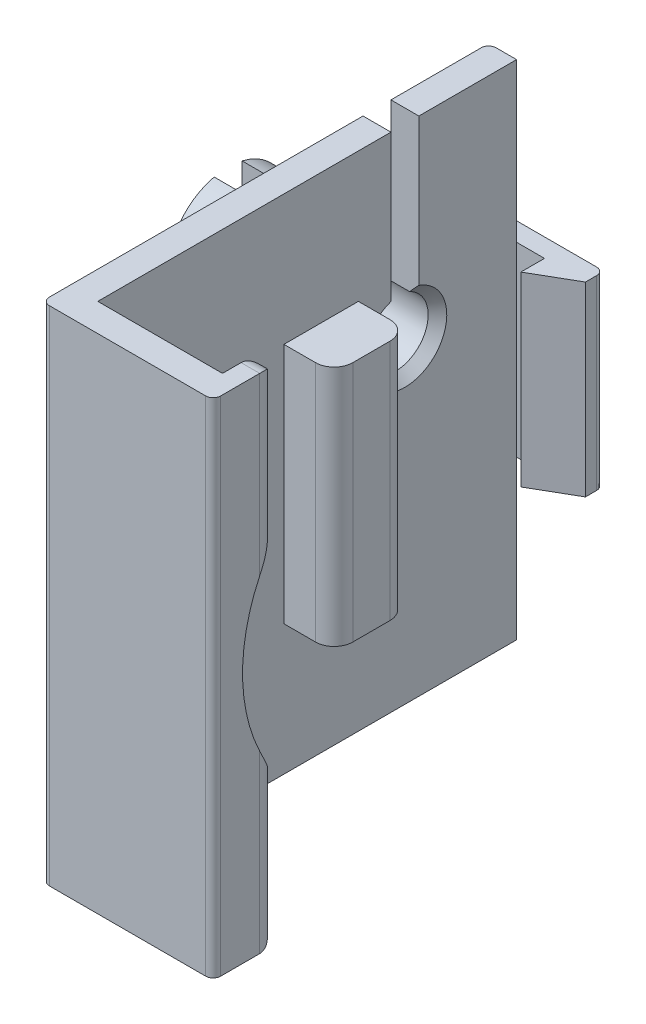
from build123d import *

# Parameters (mm, degrees)
BOSS_EXTRUDE1_DEPTH      = 5
BOSS_EXTRUDE1_DEPTH_BACK = 5
SKETCH2_W                = 3.7
SKETCH2_H                = 10
BOSS_EXTRUDE2_DEPTH      = 1
SKETCH3_W                = 1
SKETCH3_H                = 10
BOSS_EXTRUDE3_DEPTH      = 1.5
SKETCH4_W                = 6.7
SKETCH4_H                = 27
SKETCH4_W_2              = 1.5
BOSS_EXTRUDE4_DEPTH      = 1.5
SKETCH5_W                = 4
SKETCH5_H                = 13
BOSS_EXTRUDE5_DEPTH      = 2.7
CUT_EXTRUDE1_DEPTH       = 29.339724769
BOSS_EXTRUDE6_START      = -1.5
BOSS_EXTRUDE6_DEPTH      = 8
CUT_EXTRUDE2_START       = -3.25
SKETCH8_W                = 4.8
SKETCH8_H                = 6.5
CUT_EXTRUDE2_DEPTH       = 3.25
FILLET4_R                = 1
CHAMFER1_SIZE            = 2
CHAMFER3_SIZE            = 0.5
SKETCH4_3_W              = 1
SKETCH4_3_H              = 27
BOSS_EXTRUDE7_DEPTH      = 2
SKETCH4_4_W              = 1
SKETCH4_4_H              = 27
BOSS_EXTRUDE8_DEPTH      = 1.5
FILLET6_R                = 1
FILLET8_R                = 0.4
SKETCH9_R                = 9.5
CUT_EXTRUDE3_DEPTH       = 32.948239388


with BuildPart() as part:
    # Sketch1 → Boss-Extrude1 (new, two sides: drawn at the far end of the back side and taken through both)
    with BuildSketch(Plane(origin=(0, 0, 0), x_dir=(1, 0, 0), z_dir=(0, 1, 0)).offset(-BOSS_EXTRUDE1_DEPTH_BACK)):
        Polygon((0, 0), (-2.2, 0), (-2.2, -1.270170592), align=None)
    extrude(amount=BOSS_EXTRUDE1_DEPTH + BOSS_EXTRUDE1_DEPTH_BACK)

    # Sketch2 → Boss-Extrude2 (add)
    with BuildSketch(Plane(origin=(0, 0, 0), x_dir=(-1, 0, 0), z_dir=(0, 0, -1))):
        with Locations((1.85, 0)):
            Rectangle(SKETCH2_W, SKETCH2_H)
    extrude(amount=BOSS_EXTRUDE2_DEPTH)

    # Sketch3 → Boss-Extrude3 (add)
    with BuildSketch(Plane.ZY.offset(3.7)):
        Polygon((0, -5), (0, -13.5), (22.5, -13.5), (22.5, 13.5), (0, 13.5), (0, 5), align=None)
        with Locations((-0.5, 0)):
            Rectangle(SKETCH3_W, SKETCH3_H)
    extrude(amount=BOSS_EXTRUDE3_DEPTH)

    # Sketch4 → Boss-Extrude4 (add)
    with BuildSketch(Plane.XY.offset(22.5)):
        with Locations((-0.35, 0)):
            Rectangle(SKETCH4_W, SKETCH4_H)
        with Locations((-4.45, 0)):
            Rectangle(SKETCH4_W_2, SKETCH4_H)
    extrude(amount=BOSS_EXTRUDE4_DEPTH)

    # Sketch5 → Boss-Extrude5 (add)
    with BuildSketch(Plane(origin=(-3.7, 0, 0), x_dir=(0, 0, -1), z_dir=(1, 0, 0))):
        with Locations((-10.5, 0)):
            Rectangle(SKETCH5_W, SKETCH5_H)
    extrude(amount=BOSS_EXTRUDE5_DEPTH)

    # Sketch7 → Cut-Extrude1 (cut, through all)
    with BuildSketch(Plane(origin=(-3.7, 0, 0), x_dir=(0, 0, -1), z_dir=(1, 0, 0))):
        with BuildLine():
            Line((-5.25, 5.08113883), (-5.25, 13.5))
            Line((-5.25, 13.5), (-6.75, 13.5))
            Line((-6.75, 13.5), (-6.75, 5.08113883))
            ThreePointArc((-6.75, 5.08113883), (-6, 1.75), (-5.25, 5.08113883))
        make_face()
    extrude(amount=-CUT_EXTRUDE1_DEPTH, mode=Mode.SUBTRACT)

    # Sketch7<3> → Boss-Extrude6 (add)
    with BuildSketch(Plane(origin=(-3.7, 0, 0), x_dir=(0, 0, -1), z_dir=(1, 0, 0)).offset(BOSS_EXTRUDE6_START)):
        with BuildLine():
            Line((-8.5, 1.423344034), (-8.5, 5.576655966))
            ThreePointArc((-8.5, 5.576655966), (-9.25, 3.5), (-8.5, 1.423344034))
        make_face()
        with BuildLine():
            Line((-6.75, 5.08113883), (-6.75, 6.66227766))
            ThreePointArc((-6.75, 6.66227766), (-7.713262565, 6.261744265), (-8.5, 5.576655966))
            Line((-8.5, 5.576655966), (-8.5, 1.423344034))
            ThreePointArc((-8.5, 1.423344034), (-4.896029892, 0.443245185), (-2.75, 3.5))
            ThreePointArc((-2.75, 3.5), (-3.450490243, 5.515564437), (-5.25, 6.66227766))
            Line((-5.25, 6.66227766), (-5.25, 5.08113883))
            ThreePointArc((-5.25, 5.08113883), (-4.520980054, 4.435414347), (-4.25, 3.5))
            ThreePointArc((-4.25, 3.5), (-6.935414347, 2.020980054), (-6.75, 5.08113883))
        make_face()
    extrude(amount=-BOSS_EXTRUDE6_DEPTH)

    # Sketch8 → Cut-Extrude2 (cut)
    with BuildSketch(Plane(origin=(0, 0.25, 0), x_dir=(-1, 0, 0), z_dir=(0, -1, 0)).offset(CUT_EXTRUDE2_START)):
        with Locations((10.8, -6)):
            Rectangle(SKETCH8_W, SKETCH8_H)
    extrude(amount=CUT_EXTRUDE2_DEPTH, mode=Mode.SUBTRACT)

    # Fillet4
    fillet4_edges = [part.edges().sort_by_distance(p)[0] for p in [
        (-1, 0, 8.5),
        (-1, 0, 12.5),
    ]]
    fillet(fillet4_edges, radius=FILLET4_R)

    # Chamfer1
    # the kernel refuses this chamfer: 2 mm, written as the material it adds along each edge
    with BuildSketch(Plane(origin=(-8.4, 3.5, -2.393365976), x_dir=(0.027495876610586487, -0.9996219169112968, 0), z_dir=(0, 0, 1))) as chamfer1_piece_1_section:
        Polygon((CHAMFER1_SIZE * 0.999621916911, -CHAMFER1_SIZE * 0.0274958766106), (-CHAMFER1_SIZE * 0.0274958766106, -CHAMFER1_SIZE * 0.999621916911), (0, 0), align=None)
    chamfer1_piece_1 = extrude(amount=11.786731952, mode=Mode.PRIVATE)
    chamfer1_piece_1 = chamfer1_piece_1 - Plane(origin=(-8.681951998, 3.5, 6), x_dir=(0, 0.9035079029052511, -0.4285714285714289), z_dir=(1, 0, 0)) * Cylinder(1.75, 32, mode=Mode.PRIVATE)
    chamfer1_piece_1 = chamfer1_piece_1 & Plane(origin=(-8.681951998, 3.5, 6), x_dir=(0, 0.6389710663783268, 0.7692307692307582), z_dir=(1, 0, 0)) * Cylinder(3.25, 32, mode=Mode.PRIVATE)
    add(chamfer1_piece_1)
    with BuildSketch(Plane(origin=(-8.4, 3.5, 2.606634024), x_dir=(-0.9996219169112968, 0.02749587661058627, 0), z_dir=(0, 0, 1))) as chamfer1_piece_2_section:
        Polygon((CHAMFER1_SIZE * 0.999621916911, CHAMFER1_SIZE * 0.0274958766106), (-CHAMFER1_SIZE * 0.0274958766106, CHAMFER1_SIZE * 0.999621916911), (0, 0), align=None)
    chamfer1_piece_2 = extrude(amount=11.786731952, mode=Mode.PRIVATE)
    chamfer1_piece_2 = chamfer1_piece_2 - Plane(origin=(-10.090710098, 3.5, 6), x_dir=(0, 0.9035079029052511, -0.4285714285714289), z_dir=(1, 0, 0)) * Cylinder(1.75, 32, mode=Mode.PRIVATE)
    chamfer1_piece_2 = chamfer1_piece_2 & Plane(origin=(-10.090710098, 3.5, 6), x_dir=(0, 0.6389710663783268, 0.7692307692307582), z_dir=(1, 0, 0)) * Cylinder(3.25, 32, mode=Mode.PRIVATE)
    add(chamfer1_piece_2)

    # Chamfer3
    chamfer3_edges = [part.edges().sort_by_distance(p)[0] for p in [
        (-3.7, 1.75, 6),
    ]]
    chamfer(chamfer3_edges, length=CHAMFER3_SIZE)



with BuildPart() as body_2:
    # Sketch4<3> → Boss-Extrude7 (new body)
    with BuildSketch(Plane.XY.offset(22.5)):
        with Locations((3.5, 0)):
            Rectangle(SKETCH4_3_W, SKETCH4_3_H)
    extrude(amount=-BOSS_EXTRUDE7_DEPTH)


with BuildPart() as part_1:
    add(part.part)

    add(body_2.part)  # Boss-Extrude8 merges body 2
    # Sketch4<4> → Boss-Extrude8 (add)
    with BuildSketch(Plane.XY.offset(22.5)):
        with Locations((3.5, 0)):
            Rectangle(SKETCH4_4_W, SKETCH4_4_H)
        with Locations((3.5, 0)):
            Rectangle(SKETCH4_4_W, SKETCH4_4_H)
        with Locations((3.5, 0)):
            Rectangle(SKETCH4_4_W, SKETCH4_4_H)
    extrude(amount=BOSS_EXTRUDE8_DEPTH)

    # Fillet6
    # the kernel refuses this fillet: 1 mm, written as the material it takes off along each edge
    with BuildSketch(Plane(origin=(6.5, -13.5, 20.5), x_dir=(0, 0, 1), z_dir=(-1, 0, 0))) as fillet6_piece_1:
        with BuildLine():
            CenterArc((FILLET6_R, FILLET6_R), FILLET6_R, 180, 90)
            Line((0, FILLET6_R), (0, 0))
            Line((0, 0), (FILLET6_R, 0))
        make_face()
    extrude(amount=6, mode=Mode.SUBTRACT)
    with BuildSketch(Plane(origin=(4, 16, 20.5), x_dir=(-1, 0, 0), z_dir=(0, -1, 0))) as fillet6_piece_2:
        with BuildLine():
            CenterArc((FILLET6_R, -FILLET6_R), FILLET6_R, 90, 90)
            Line((0, -FILLET6_R), (0, 0))
            Line((0, 0), (FILLET6_R, 0))
        make_face()
    extrude(amount=32, mode=Mode.SUBTRACT)
    with BuildSketch(Plane(origin=(3, -16, 20.5), x_dir=(0, 0, 1), z_dir=(0, 1, 0))) as fillet6_piece_3:
        with BuildLine():
            CenterArc((FILLET6_R, FILLET6_R), FILLET6_R, 180, 90)
            Line((0, FILLET6_R), (0, 0))
            Line((0, 0), (FILLET6_R, 0))
        make_face()
    extrude(amount=32, mode=Mode.SUBTRACT)
    with BuildSketch(Plane(origin=(0.5, 13.5, 20.5), x_dir=(0, -1, 0), z_dir=(1, 0, 0))) as fillet6_piece_4:
        with BuildLine():
            CenterArc((FILLET6_R, -FILLET6_R), FILLET6_R, 90, 90)
            Line((0, -FILLET6_R), (0, 0))
            Line((0, 0), (FILLET6_R, 0))
        make_face()
    extrude(amount=6, mode=Mode.SUBTRACT)

    # Fillet8
    fillet8_edges = [part_1.edges().sort_by_distance(p)[0] for p in [
        (4, 0, 24),
        (0, 0, -1),
        (-5.2, 9.25, 0),
        (-5.2, -9.25, 0),
        (-5.2, 0, -1),
        (-5.2, 0, 24),
    ]]
    fillet(fillet8_edges, radius=FILLET8_R)

    # Sketch9 → Cut-Extrude3 (cut, through all)
    with BuildSketch(Plane.ZY.offset(-3)):
        with Locations((12.921330644, 0)):
            Circle(SKETCH9_R)
    extrude(amount=-CUT_EXTRUDE3_DEPTH, mode=Mode.SUBTRACT)


solid = part_1.part
